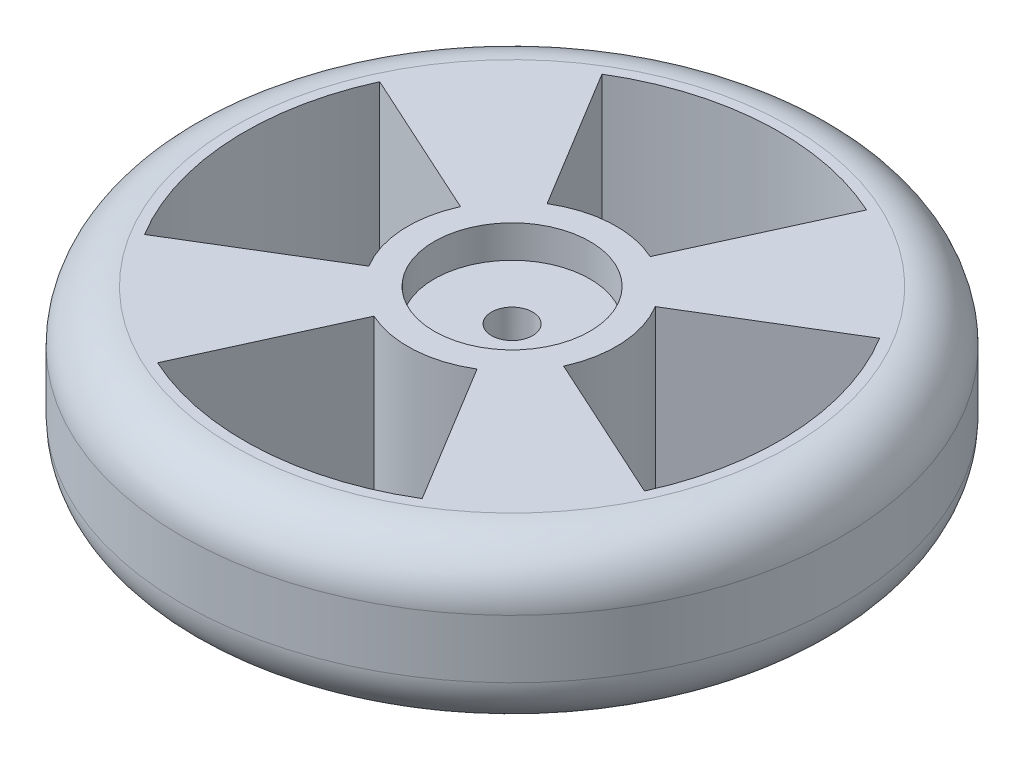
from build123d import *

# Parameters (mm, degrees)
SKETCH1_R           = 50.8
BOSS_EXTRUDE1_DEPTH = 25
FILLET2_R           = 8
FILLET3_R           = 8
SKETCH2_R           = 15
BOSS_EXTRUDE2_DEPTH = 5
SKETCH3_R           = 12
CUT_EXTRUDE1_DEPTH  = 5
FILLET4_R           = 8
SKETCH5_R           = 3.165
CUT_EXTRUDE2_DEPTH  = 78.85422275
CUT_EXTRUDE3_DEPTH  = 78.85422275


with BuildPart() as part:
    # Sketch1 → Boss-Extrude1 (new body)
    with BuildSketch(Plane(origin=(0, 0, 0), x_dir=(1, 0, 0), z_dir=(0, 1, 0))):
        with Locations(Location((0, 0, 0), (0, 0, 270))):
            Circle(SKETCH1_R)
    extrude(amount=BOSS_EXTRUDE1_DEPTH)

    # Fillet2
    fillet2_edges = [part.edges().sort_by_distance(p)[0] for p in [
        (0, 25, -50.8),
    ]]
    fillet(fillet2_edges, radius=FILLET2_R)

    # Fillet3
    fillet3_edges = [part.edges().sort_by_distance(p)[0] for p in [
        (0, 0, -50.8),
    ]]
    fillet(fillet3_edges, radius=FILLET3_R)

    # Sketch2 → Boss-Extrude2 (add)
    with BuildSketch(Plane.XZ):
        with Locations(Location((0, 0, 0), (0, 0, 90))):
            Circle(SKETCH2_R)
    extrude(amount=BOSS_EXTRUDE2_DEPTH)

    # Sketch3 → Cut-Extrude1 (cut)
    with BuildSketch(Plane(origin=(0, 25, 0), x_dir=(1, 0, 0), z_dir=(0, 1, 0))):
        with Locations(Location((0, 0, 0), (0, 0, 270))):
            Circle(SKETCH3_R)
    extrude(amount=-CUT_EXTRUDE1_DEPTH, mode=Mode.SUBTRACT)

    # Fillet4
    # the kernel refuses this fillet: 8 mm, written as the material it adds along each edge
    with BuildSketch(Plane(origin=(0, 0, 0), x_dir=(0, 0, 1), z_dir=(1, 0, 0))) as fillet4_piece_1:
        with BuildLine():
            CenterArc((22.416198487, 8), FILLET4_R, 202.024312837, 67.975687163)
            Line((15, 5), (14.85167603, 4.94))
            ThreePointArc((14.85167603, 4.94), (14.84, 2.5), (14.84, 0))
            Line((14.84, 0), (15, -0.16))
            Line((15, -0.16), (22.416198487, -0.16))
            Line((22.416198487, -0.16), (22.416198487, 0))
        make_face()
    revolve(axis=Axis((0, 0, 0), (0, -1, 0)))

    # Sketch5 → Cut-Extrude2 (cut, through all)
    with BuildSketch(Plane.XZ.offset(5)):
        with Locations(Location((0, 0, 0), (0, 0, 270))):
            Circle(SKETCH5_R)
    extrude(amount=-CUT_EXTRUDE2_DEPTH, mode=Mode.SUBTRACT)

    # Sketch6 → Cut-Extrude3 (cut, through all)
    with BuildSketch(Plane(origin=(0, 25, 0), x_dir=(1, 0, 0), z_dir=(0, 1, 0))):
        with BuildLine():
            Line((6.669640143, 14.619160774), (17.119775233, 37.524775128))
            ThreePointArc((17.119775233, 37.524775128), (-2.42176691, 41.174391282), (-21.4007271, 35.259102825))
            Line((-21.4007271, 35.259102825), (-8.337442905, 13.736484528))
            ThreePointArc((-8.337442905, 13.736484528), (-0.943488661, 16.041003414), (6.669640143, 14.619160774))
        make_face()
        with BuildLine():
            Line((13.736484528, 8.337442905), (35.259102825, 21.4007271))
            ThreePointArc((35.259102825, 21.4007271), (41.174391282, 2.42176691), (37.524775128, -17.119775233))
            Line((37.524775128, -17.119775233), (14.619160774, -6.669640143))
            ThreePointArc((14.619160774, -6.669640143), (16.041003414, 0.943488661), (13.736484528, 8.337442905))
        make_face()
        with BuildLine():
            Line((8.337442905, -13.736484528), (21.4007271, -35.259102825))
            ThreePointArc((21.4007271, -35.259102825), (2.42176691, -41.174391282), (-17.119775233, -37.524775128))
            Line((-17.119775233, -37.524775128), (-6.669640143, -14.619160774))
            ThreePointArc((-6.669640143, -14.619160774), (0.943488661, -16.041003414), (8.337442905, -13.736484528))
        make_face()
        with BuildLine():
            Line((-13.736484528, -8.337442905), (-35.259102825, -21.4007271))
            ThreePointArc((-35.259102825, -21.4007271), (-41.174391282, -2.42176691), (-37.524775128, 17.119775233))
            Line((-37.524775128, 17.119775233), (-14.619160774, 6.669640143))
            ThreePointArc((-14.619160774, 6.669640143), (-16.041003414, -0.943488661), (-13.736484528, -8.337442905))
        make_face()
    extrude(amount=-CUT_EXTRUDE3_DEPTH, mode=Mode.SUBTRACT)


solid = part.part
